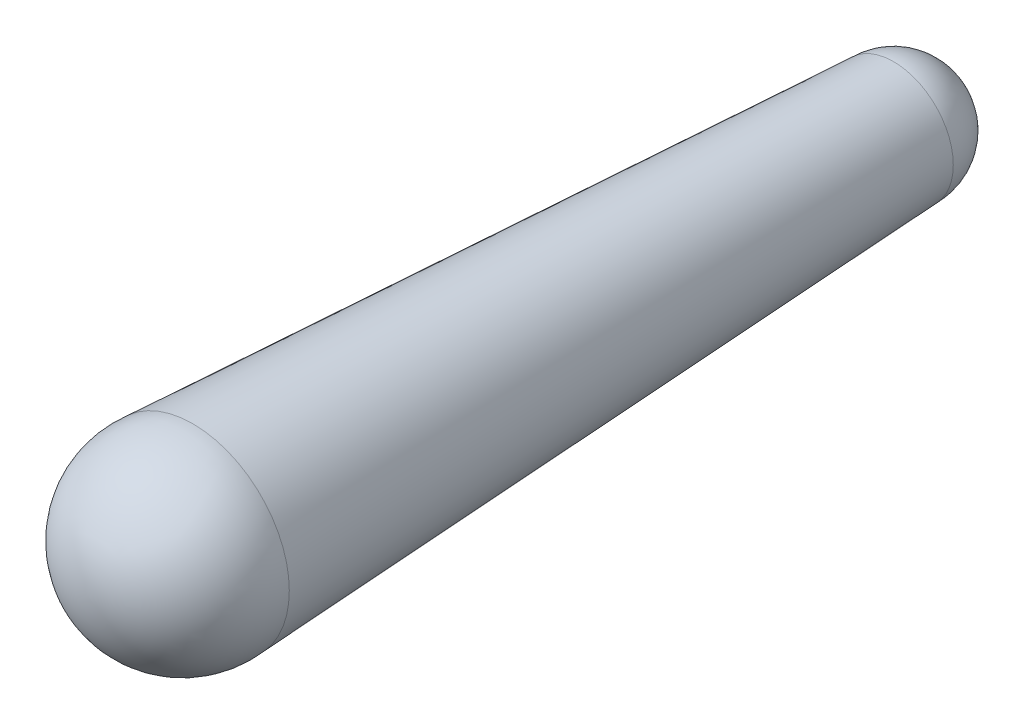
from build123d import *

# Parameters (mm, degrees)
SKETCH1_R           = 57.15
BOSS_EXTRUDE1_DEPTH = 419.1
BOSS_EXTRUDE1_DRAFT = -3


# Read off the part's stored shape, not the designer's step: Revolve2
with BuildPart() as part:
    # Sketch1 → Boss-Extrude1 (with draft: the straight prism first)
    with BuildSketch(Plane.XY):
        Circle(SKETCH1_R)
    extrude(amount=-BOSS_EXTRUDE1_DEPTH)
    # Boss-Extrude1: the draft: its side faces are tilted about the plane it starts from
    boss_extrude1_sides = [part.faces().sort_by_distance(p)[0] for p in [
        (-57.15, 0, -209.55),
    ]]
    draft(boss_extrude1_sides, Plane.XY, BOSS_EXTRUDE1_DRAFT)

    # Sketch4 → Revolve1 (revolve)
    with BuildSketch(Plane(origin=(0, 0, 0), x_dir=(0, 0, -1), z_dir=(1, 0, 0))):
        with BuildLine():
            Line((419.1, 35.185899702), (419.1, -35.185899702))
            ThreePointArc((419.1, -35.185899702), (454.285899702, 0), (419.1, 35.185899702))
        make_face()
    revolve(axis=Axis((0, 35.185899702, -419.1), (0, -1, 0)))

    # Revolve2 outline → Revolve2 (revolve)
    with BuildSketch(Plane.XZ):
        with BuildLine():
            Line((56.836926314, 0), (56.836926314, -5.973801733))
            ThreePointArc((56.836926314, -5.973801733), (42.470726795, 38.240814132), (0, 57.15))
            Line((0, 57.15), (0, 0))
            Line((0, 0), (56.836926314, 0))
        make_face()
    revolve(axis=Axis((0, 0, 0), (0, 0, 1)))


solid = part.part
